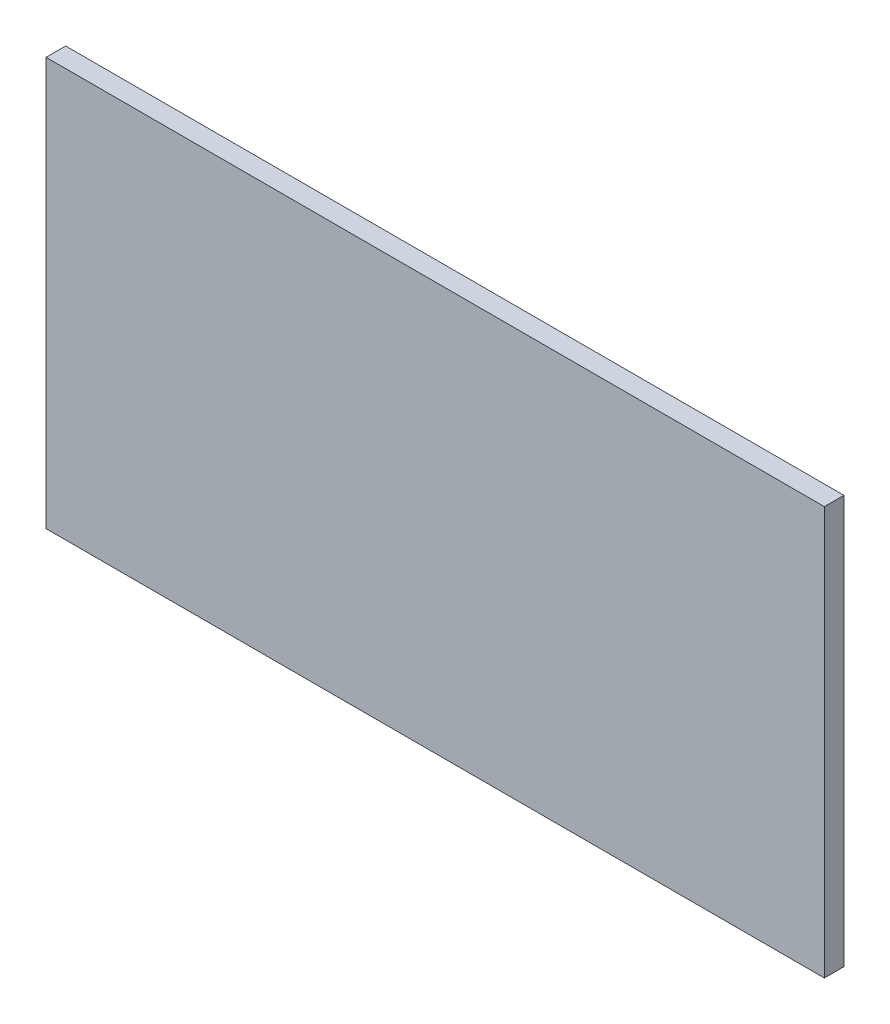
from build123d import *

# Parameters (mm, degrees)
SKETCH_1_W      = 79.5
SKETCH_1_H      = 41.7
EXTRUDE_1_DEPTH = 2


with BuildPart() as part:
    # Эскиз1 → Бобышка-Вытянуть1 (new body)
    with BuildSketch(Plane.XY):
        Rectangle(SKETCH_1_W, SKETCH_1_H)
    extrude(amount=EXTRUDE_1_DEPTH)


solid = part.part
